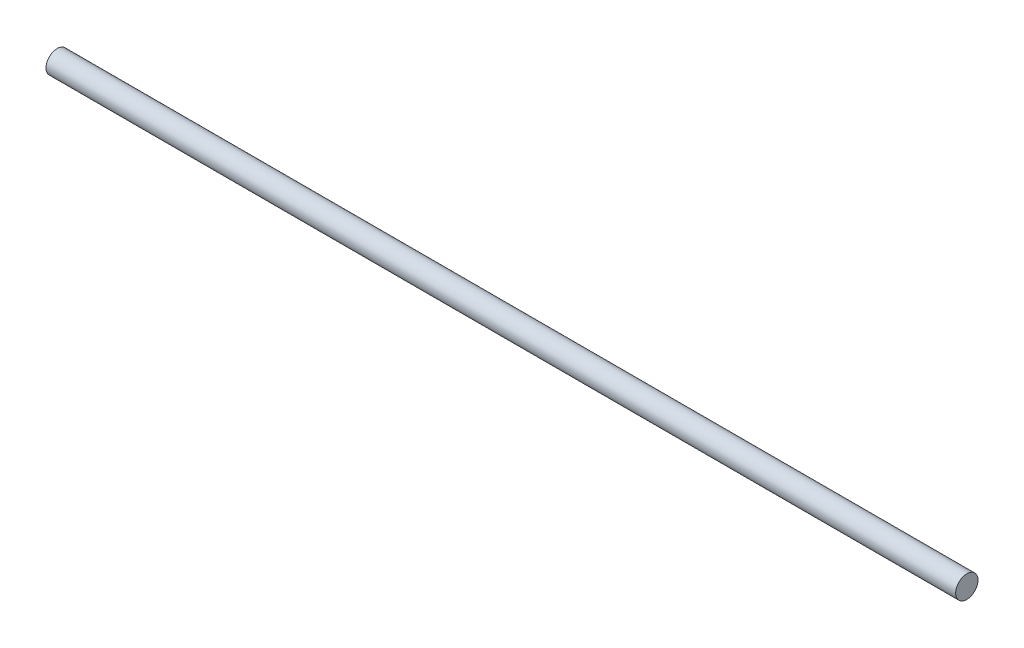
from build123d import *

# Parameters (mm, degrees)
SKETCH1_R           = 3.429
BOSS_EXTRUDE1_DEPTH = 279.4


with BuildPart() as part:
    # Sketch1 → Boss-Extrude1 (new body)
    with BuildSketch(Plane(origin=(0, 0, 0), x_dir=(0, 0, -1), z_dir=(1, 0, 0))):
        Circle(SKETCH1_R)
    extrude(amount=BOSS_EXTRUDE1_DEPTH)


solid = part.part
